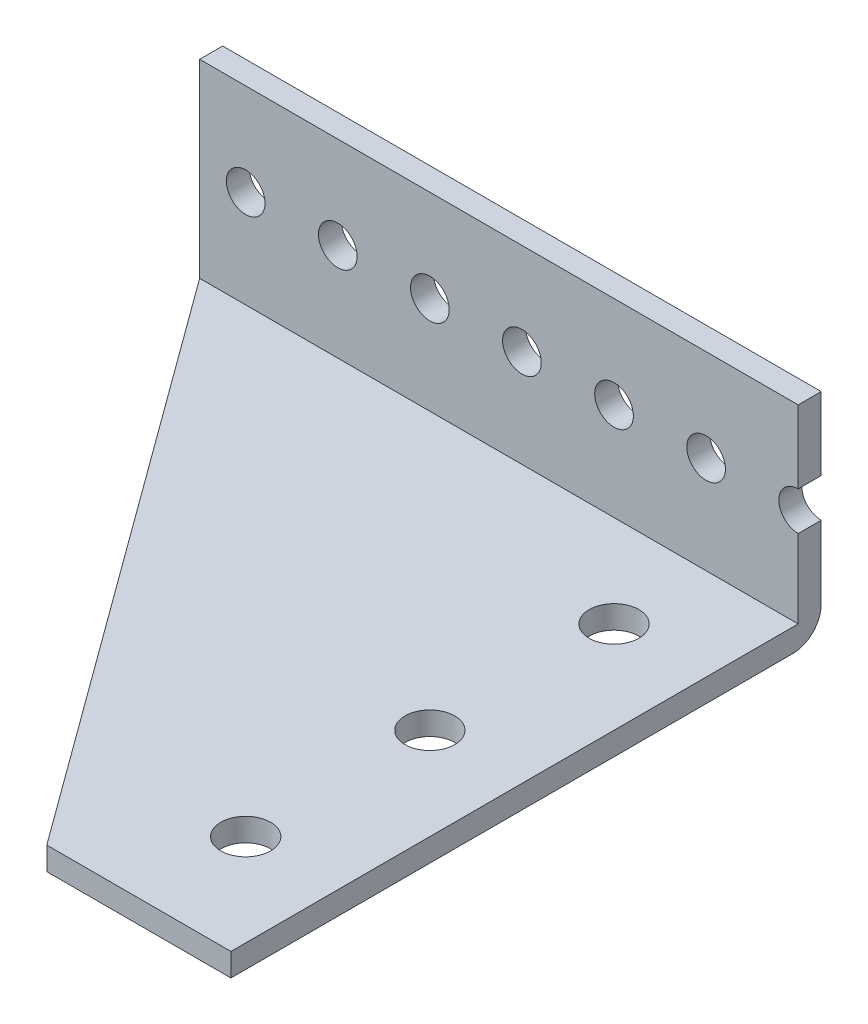
from build123d import *

# Parameters (mm, degrees)
BOSS_EXTRUDE1_START    = -34.925
SKETCH1_W              = 82.55
SKETCH1_H              = 81.407
BOSS_EXTRUDE1_DEPTH    = 3.175
SKETCH3_W              = 82.55
SKETCH3_H              = 3.175
BOSS_EXTRUDE2_DEPTH    = 50.8
F_10_CLEARANCE_HOLE2_D = 5.334
CHAMFER1_SIZE          = 3.175
FILLET2_R              = 3.937
SKETCH9_R              = 3.429
CUT_EXTRUDE2_DEPTH     = 80.206698973
SKETCH10_W             = 82.55
SKETCH10_H             = 24.638
CUT_EXTRUDE3_DEPTH     = 98.726561891


with BuildPart() as part:
    # Sketch1 → Boss-Extrude1 (new body)
    with BuildSketch(Plane(origin=(0, 0, 0), x_dir=(1, 0, 0), z_dir=(0, 1, 0)).offset(BOSS_EXTRUDE1_START)):
        Rectangle(SKETCH1_W, SKETCH1_H)
    extrude(amount=BOSS_EXTRUDE1_DEPTH)

    # Sketch3 → Boss-Extrude2 (add)
    with BuildSketch(Plane(origin=(0, -31.75, 0), x_dir=(1, 0, 0), z_dir=(0, 1, 0))):
        with Locations((0, 39.116)):
            Rectangle(SKETCH3_W, SKETCH3_H)
    extrude(amount=BOSS_EXTRUDE2_DEPTH)

    # #10 Clearance Hole2 (through all)
    with Locations(Plane(origin=(0, 0, -40.7035), x_dir=(-1, 0, 0), z_dir=(0, 0, -1))):
        with Locations((22.225, 7.112), (9.525, 7.112), (-3.175, 7.112), (-15.875, 7.112), (-28.575, 7.112), (22.225, -18.288), (9.525, -18.288), (-3.175, -18.288), (-15.875, -18.288), (-28.575, -18.288), (34.925, 7.112), (34.925, -18.288), (-41.275, 7.112), (-41.275, -18.288)):
            Hole(F_10_CLEARANCE_HOLE2_D / 2)

    # Chamfer1
    chamfer1_edges = [part.edges().sort_by_distance(p)[0] for p in [
        (-41.275, 19.05, -39.116),
    ]]
    chamfer(chamfer1_edges, length=CHAMFER1_SIZE)

    # Fillet2
    fillet2_edges = [part.edges().sort_by_distance(p)[0] for p in [
        (0, -34.925, -40.7035),
    ]]
    fillet(fillet2_edges, radius=FILLET2_R)

    # Sketch9 → Cut-Extrude2 (cut, through all)
    with BuildSketch(Plane.XZ.offset(34.925)):
        with Locations((28.575, -24.8285)):
            Circle(SKETCH9_R)
        with Locations((28.575, 0.5715)):
            Circle(SKETCH9_R)
        with Locations((28.575, 25.9715)):
            Circle(SKETCH9_R)
        Polygon((-41.275, -37.5285), (-41.275, 40.7035), (15.875, 40.7035), align=None)
    extrude(amount=-CUT_EXTRUDE2_DEPTH, mode=Mode.SUBTRACT)

    # Sketch10 → Cut-Extrude3 (cut, through all)
    with BuildSketch(Plane(origin=(0, 0, -40.7035), x_dir=(-1, 0, 0), z_dir=(0, 0, -1))):
        with Locations((0, 6.731)):
            Rectangle(SKETCH10_W, SKETCH10_H)
    extrude(amount=-CUT_EXTRUDE3_DEPTH, mode=Mode.SUBTRACT)


solid = part.part
